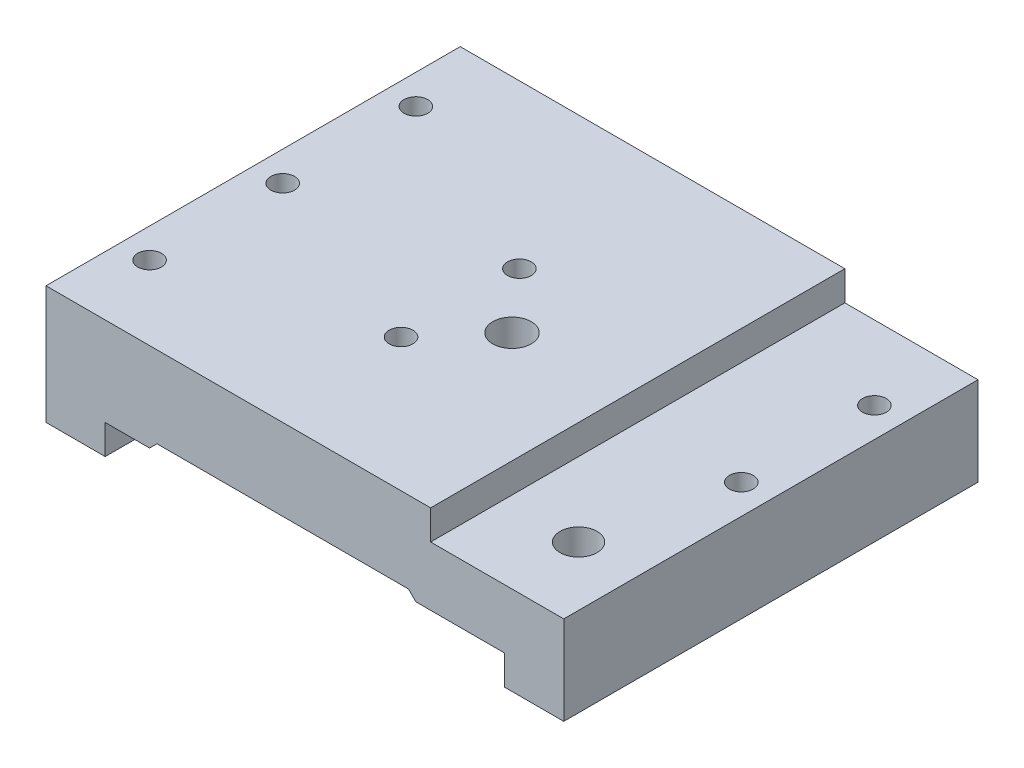
from build123d import *

# Parameters (mm, degrees)
SKETCH1_W                   = 111.125
SKETCH1_H                   = 88.9
BOSS_EXTRUDE1_DEPTH         = 25.4
SKETCH2_W                   = 28.575
SKETCH2_H                   = 6.35
CUT_EXTRUDE1_DEPTH          = 108.868259494
SKETCH3_R                   = 4.13258
CUT_EXTRUDE2_DEPTH          = 74.266177821
F_1_4_20_TAPPED_HOLE1_D     = 5.1054
F_1_4_20_TAPPED_HOLE1_DEPTH = 29.21
F_1_4_20_TAPPED_HOLE1_TIP   = 1.533816902
F_3_8_16_TAPPED_HOLE1_D     = 7.9375
F_3_8_16_TAPPED_HOLE1_DEPTH = 23.8125
F_3_8_16_TAPPED_HOLE1_TIP   = 2.384665582
F_1_4_20_TAPPED_HOLE2_D     = 5.1054
F_1_4_20_TAPPED_HOLE2_DEPTH = 10.16
F_1_4_20_TAPPED_HOLE2_TIP   = 1.533816902


with BuildPart() as part:
    # Sketch1 → Boss-Extrude1 (new body)
    with BuildSketch(Plane(origin=(0, 0, 0), x_dir=(1, 0, 0), z_dir=(0, 1, 0))):
        Rectangle(SKETCH1_W, SKETCH1_H)
    extrude(amount=BOSS_EXTRUDE1_DEPTH)

    # Sketch2 → Cut-Extrude1 (cut, through all)
    with BuildSketch(Plane.XY.offset(44.45)):
        Polygon((-42.8625, 0), (-42.8625, 6.35), (-33.3375, 6.35), (-31.75, 7.9375), (22.225, 7.9375), (23.8125, 6.35), (42.8625, 6.35), (42.8625, 0), align=None)
        with Locations((41.275, 22.225)):
            Rectangle(SKETCH2_W, SKETCH2_H)
    extrude(amount=-CUT_EXTRUDE1_DEPTH, mode=Mode.SUBTRACT)

    # Sketch3 → Cut-Extrude2 (cut, through all)
    with BuildSketch(Plane.XZ.offset(-7.9375)):
        with Locations((3.175, 3.175)):
            Circle(SKETCH3_R)
    extrude(amount=-CUT_EXTRUDE2_DEPTH, mode=Mode.SUBTRACT)

    # 1/4-20 Tapped Hole1
    with Locations(Plane(origin=(0, 0, 0), x_dir=(-1, 0, 0), z_dir=(0, -1, 0))):
        with Locations((49.2125, -28.575), (49.2125, 0), (49.2125, 28.575), (-49.2125, 28.575), (-49.2125, 0)):
            Hole(F_1_4_20_TAPPED_HOLE1_D / 2, depth=F_1_4_20_TAPPED_HOLE1_DEPTH)
            with Locations((0, 0, -(F_1_4_20_TAPPED_HOLE1_DEPTH + F_1_4_20_TAPPED_HOLE1_TIP / 2))):  # 118° drill point
                Cone(0, F_1_4_20_TAPPED_HOLE1_D / 2, F_1_4_20_TAPPED_HOLE1_TIP, mode=Mode.SUBTRACT)

    # 3/8-16 Tapped Hole1
    with Locations(Plane(origin=(0, 0, 0), x_dir=(-1, 0, 0), z_dir=(0, -1, 0))):
        with Locations((-42.8625, -28.575)):
            Hole(F_3_8_16_TAPPED_HOLE1_D / 2, depth=F_3_8_16_TAPPED_HOLE1_DEPTH)
            with Locations((0, 0, -(F_3_8_16_TAPPED_HOLE1_DEPTH + F_3_8_16_TAPPED_HOLE1_TIP / 2))):  # 118° drill point
                Cone(0, F_3_8_16_TAPPED_HOLE1_D / 2, F_3_8_16_TAPPED_HOLE1_TIP, mode=Mode.SUBTRACT)

    # 1/4-20 Tapped Hole2
    with Locations(Plane(origin=(0, 25.4, 0), x_dir=(1, 0, 0), z_dir=(0, 1, 0))):
        with Locations((-7.9375, -15.875), (-7.9375, 9.525)):
            Hole(F_1_4_20_TAPPED_HOLE2_D / 2, depth=F_1_4_20_TAPPED_HOLE2_DEPTH)
            with Locations((0, 0, -(F_1_4_20_TAPPED_HOLE2_DEPTH + F_1_4_20_TAPPED_HOLE2_TIP / 2))):  # 118° drill point
                Cone(0, F_1_4_20_TAPPED_HOLE2_D / 2, F_1_4_20_TAPPED_HOLE2_TIP, mode=Mode.SUBTRACT)


solid = part.part
